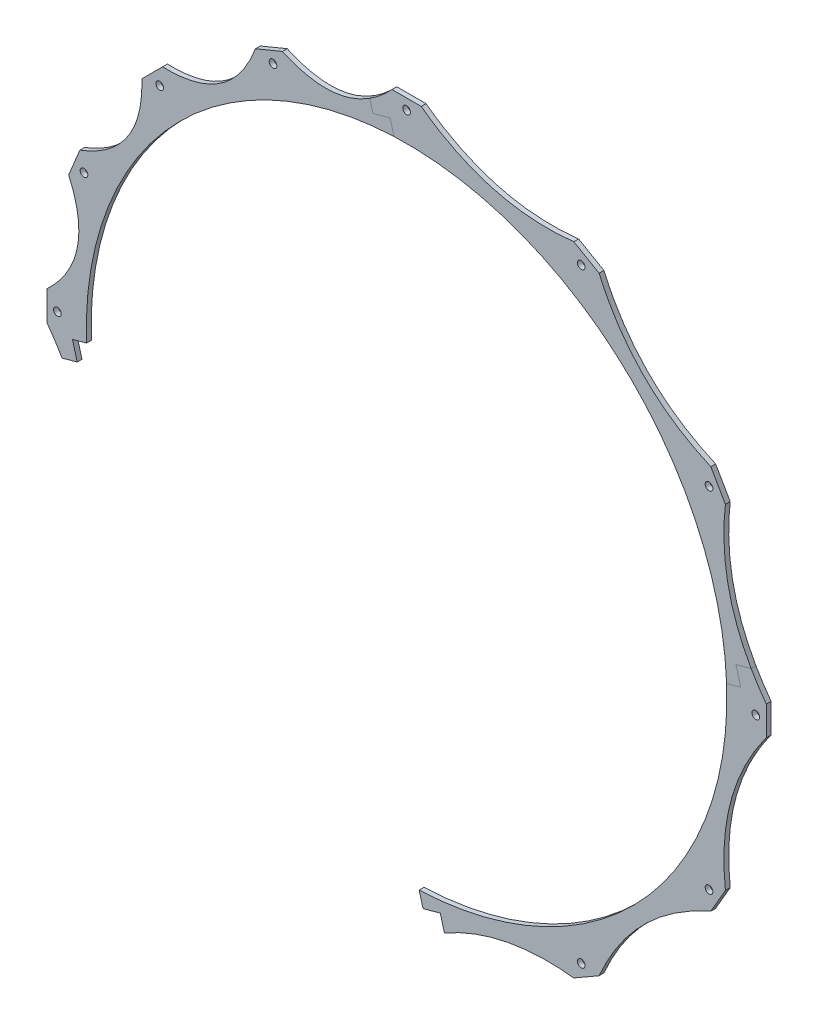
from build123d import *

# Parameters (mm, degrees)
SKETCH4_R           = 169.4688
SKETCH4_R_2         = 2.032
BOSS_EXTRUDE2_DEPTH = 2.54
SPLIT1_START        = -187
SPLIT1_OUTLINE_W    = 217.001338611
SPLIT1_OUTLINE_H    = 2.54
SPLIT1_DEPTH        = 373.122397647
SPLIT1_START_2      = 38.456242575
SPLIT1_2_OUTLINE_W  = 157.998661389
SPLIT1_2_OUTLINE_H  = 2.54
SPLIT1_2_DEPTH      = 147.666155072
SPLIT1_START_3      = 29.001338611
SPLIT1_3_OUTLINE_W  = 14.199535353
SPLIT1_3_OUTLINE_H  = 2.54
SPLIT1_3_DEPTH      = 9.454903964
SPLIT1_START_4      = -172.800464647
SPLIT1_4_OUTLINE_W  = 9.454903964
SPLIT1_4_OUTLINE_H  = 2.54
SPLIT1_4_DEPTH      = 31.915852609
SPLIT1_5_OUTLINE_R  = 2.032
SPLIT1_5_DEPTH      = 2.54
SPLIT1_6_OUTLINE_R  = 2.032
SPLIT1_6_DEPTH      = 2.54


with BuildPart() as part:
    # Sketch4 → Boss-Extrude2 (new body)
    with BuildSketch(Plane.XY):
        with BuildLine():
            Line((-7.735342369, 190.342886598), (7.735342369, 190.342886598))
            add(Edge.make_bspline(
                [(7.735342369, 190.342886598), (43.849986057, 163.650375876), (88.472440301, 168.709446408)],
                knots=[0, 0, 0, 1, 1, 1], degree=2))
            Line((88.472440301, 168.709446408), (101.870446297, 160.974104039))
            add(Edge.make_bspline(
                [(101.870446297, 160.974104039), (119.800389819, 119.800389819), (160.974104039, 101.870446297)],
                knots=[0, 0, 0, 1, 1, 1], degree=2))
            Line((160.974104039, 101.870446297), (168.709446408, 88.472440301))
            add(Edge.make_bspline(
                [(168.709446408, 88.472440301), (163.650375876, 43.849986057), (190.342886598, 7.735342369)],
                knots=[0, 0, 0, 1, 1, 1], degree=2))
            Line((190.342886598, 7.735342369), (190.342886598, -7.735342369))
            add(Edge.make_bspline(
                [(190.342886598, -7.735342369), (163.650375876, -43.849986057), (168.709446408, -88.472440301)],
                knots=[0, 0, 0, 1, 1, 1], degree=2))
            Line((168.709446408, -88.472440301), (160.974104039, -101.870446297))
            add(Edge.make_bspline(
                [(160.974104039, -101.870446297), (119.800389819, -119.800389819), (101.870446297, -160.974104039)],
                knots=[0, 0, 0, 1, 1, 1], degree=2))
            Line((101.870446297, -160.974104039), (88.472440301, -168.709446408))
            add(Edge.make_bspline(
                [(88.472440301, -168.709446408), (43.849986057, -163.650375876), (7.735342369, -190.342886598)],
                knots=[0, 0, 0, 1, 1, 1], degree=2))
            Line((7.735342369, -190.342886598), (-7.735342369, -190.342886598))
            add(Edge.make_bspline(
                [(-7.735342369, -190.342886598), (-43.849986057, -163.650375876), (-88.472440301, -168.709446408)],
                knots=[0, 0, 0, 1, 1, 1], degree=2))
            Line((-88.472440301, -168.709446408), (-101.870446297, -160.974104039))
            add(Edge.make_bspline(
                [(-101.870446297, -160.974104039), (-119.800389819, -119.800389819), (-160.974104039, -101.870446297)],
                knots=[0, 0, 0, 1, 1, 1], degree=2))
            Line((-160.974104039, -101.870446297), (-168.709446408, -88.472440301))
            add(Edge.make_bspline(
                [(-168.709446408, -88.472440301), (-163.650375876, -43.849986057), (-190.342886598, -7.735342369)],
                knots=[0, 0, 0, 1, 1, 1], degree=2))
            Line((-190.342886598, -7.735342369), (-190.342886598, 7.735342369))
            add(Edge.make_bspline(
                [(-190.342886598, 7.735342369), (-163.877360858, 32.597233808), (-178.814084455, 65.694544678)],
                knots=[0, 0, 0, 1, 1, 1], degree=2))
            Line((-178.814084455, 65.694544678), (-172.893709719, 79.987593661))
            add(Edge.make_bspline(
                [(-172.893709719, 79.987593661), (-138.92851822, 92.829068072), (-140.062458908, 129.12303282)],
                knots=[0, 0, 0, 1, 1, 1], degree=2))
            Line((-140.062458908, 129.12303282), (-129.12303282, 140.062458908))
            add(Edge.make_bspline(
                [(-129.12303282, 140.062458908), (-92.829068072, 138.92851822), (-79.987593661, 172.893709719)],
                knots=[0, 0, 0, 1, 1, 1], degree=2))
            Line((-79.987593661, 172.893709719), (-65.694544678, 178.814084455))
            add(Edge.make_bspline(
                [(-65.694544678, 178.814084455), (-32.597233808, 163.877360858), (-7.735342369, 190.342886598)],
                knots=[0, 0, 0, 1, 1, 1], degree=2))
        make_face()
        Circle(SKETCH4_R, mode=Mode.SUBTRACT)
        with Locations((0, 184.785)):
            Circle(SKETCH4_R_2, mode=Mode.SUBTRACT)
        with Locations((-160.028504238, -92.3925)):
            Circle(SKETCH4_R_2, mode=Mode.SUBTRACT)
        with Locations((-92.3925, -160.028504238)):
            Circle(SKETCH4_R_2, mode=Mode.SUBTRACT)
        with Locations((0, -184.785)):
            Circle(SKETCH4_R_2, mode=Mode.SUBTRACT)
        with Locations((92.3925, -160.028504238)):
            Circle(SKETCH4_R_2, mode=Mode.SUBTRACT)
        with Locations((160.028504238, -92.3925)):
            Circle(SKETCH4_R_2, mode=Mode.SUBTRACT)
        with Locations((184.785, 0)):
            Circle(SKETCH4_R_2, mode=Mode.SUBTRACT)
        with Locations((160.028504238, 92.3925)):
            Circle(SKETCH4_R_2, mode=Mode.SUBTRACT)
        with Locations((92.3925, 160.028504238)):
            Circle(SKETCH4_R_2, mode=Mode.SUBTRACT)
        with Locations((-70.71415805, 170.719079415)):
            Circle(SKETCH4_R_2, mode=Mode.SUBTRACT)
        with Locations((-130.662726562, 130.662726562)):
            Circle(SKETCH4_R_2, mode=Mode.SUBTRACT)
        with Locations((-170.719079415, 70.71415805)):
            Circle(SKETCH4_R_2, mode=Mode.SUBTRACT)
        with Locations((-184.785, 0)):
            Circle(SKETCH4_R_2, mode=Mode.SUBTRACT)
    extrude(amount=BOSS_EXTRUDE2_DEPTH)

    # Split1: read off the stored shape, not the designer's step
    # Split1 outline → Split1 (cut)
    with BuildSketch(Plane(origin=(0, 0, 0), x_dir=(-0.264985399113813, 0.96425242455308, 0), z_dir=(0.96425242455308, 0.264985399113813, 0)).offset(SPLIT1_START)):
        with Locations((-79.499330695, 1.27)):
            Rectangle(SPLIT1_OUTLINE_W, SPLIT1_OUTLINE_H)
    extrude(amount=SPLIT1_DEPTH, mode=Mode.SUBTRACT)

    # Split1 2 outline → Split1 2 (cut)
    with BuildSketch(Plane(origin=(0, 0, 0), x_dir=(-0.264985399113813, 0.96425242455308, 0), z_dir=(0.96425242455308, 0.264985399113813, 0)).offset(SPLIT1_START_2)):
        with Locations((108.000669305, 1.27)):
            Rectangle(SPLIT1_2_OUTLINE_W, SPLIT1_2_OUTLINE_H)
    extrude(amount=SPLIT1_2_DEPTH, mode=Mode.SUBTRACT)

    # Split1 3 outline → Split1 3 (cut)
    with BuildSketch(Plane(origin=(0, 0, 0), x_dir=(-0.264985399113813, 0.96425242455308, 0), z_dir=(0.96425242455308, 0.264985399113813, 0)).offset(SPLIT1_START_3)):
        with Locations((179.900232324, 1.27)):
            Rectangle(SPLIT1_3_OUTLINE_W, SPLIT1_3_OUTLINE_H)
    extrude(amount=SPLIT1_3_DEPTH, mode=Mode.SUBTRACT)

    # Split1 4 outline → Split1 4 (cut)
    with BuildSketch(Plane(origin=(0, 0, 0), x_dir=(-0.264985399113813, 0.96425242455308, 0), z_dir=(0.96425242455308, 0.264985399113813, 0)).offset(SPLIT1_START_4)):
        with Locations((33.728790593, 1.27)):
            Rectangle(SPLIT1_4_OUTLINE_W, SPLIT1_4_OUTLINE_H)
    extrude(amount=SPLIT1_4_DEPTH, mode=Mode.SUBTRACT)


with BuildPart() as body_2:
    # Split1 5 outline → Split1 5 (new body)
    with BuildSketch(Plane.XY):
        with BuildLine():
            Line((169.338128785, 6.653744292), (176.813609787, 8.708074949))
            Line((176.813609787, 8.708074949), (174.308198287, 17.824989021))
            Line((174.308198287, 17.824989021), (182.318082711, 20.026178634))
            add(Edge.make_bspline(
                [(182.318082711, 20.026178634), (164.494652391, 51.29674726), (168.709446408, 88.472440301)],
                knots=[0.166883721, 0.166883721, 0.166883721, 1, 1, 1], degree=2))
            Line((168.709446408, 88.472440301), (160.974104039, 101.870446297))
            add(Edge.make_bspline(
                [(160.974104039, 101.870446297), (119.800389819, 119.800389819), (101.870446297, 160.974104039)],
                knots=[0, 0, 0, 1, 1, 1], degree=2))
            Line((101.870446297, 160.974104039), (88.472440301, 168.709446408))
            add(Edge.make_bspline(
                [(88.472440301, 168.709446408), (43.849986057, 163.650375876), (7.735342369, 190.342886598)],
                knots=[0, 0, 0, 1, 1, 1], degree=2))
            Line((7.735342369, 190.342886598), (-7.735342369, 190.342886598))
            add(Edge.make_bspline(
                [(-7.735342369, 190.342886598), (-13.406219181, 184.306228583), (-19.505563426, 180.423621815)],
                knots=[0, 0, 0, 0.228095148, 0.228095148, 0.228095148], degree=2))
            Line((-19.505563426, 180.423621815), (-17.824989021, 174.308198287))
            Line((-17.824989021, 174.308198287), (-8.708074949, 176.813609787))
            Line((-8.708074949, 176.813609787), (-6.653744292, 169.338128785))
            ThreePointArc((-6.653744292, 169.338128785), (115.035231468, 124.445046886), (169.338128785, 6.653744292))
        make_face()
        with Locations((160.028504238, 92.3925)):
            Circle(SPLIT1_5_OUTLINE_R, mode=Mode.SUBTRACT)
        with Locations((0, 184.785)):
            Circle(SPLIT1_5_OUTLINE_R, mode=Mode.SUBTRACT)
        with Locations((92.3925, 160.028504238)):
            Circle(SPLIT1_5_OUTLINE_R, mode=Mode.SUBTRACT)
    extrude(amount=SPLIT1_5_DEPTH)


with BuildPart() as body_3:
    # Split1 6 outline → Split1 6 (new body)
    with BuildSketch(Plane.XY):
        with BuildLine():
            Line((6.653744292, -169.338128785), (8.708074949, -176.813609787))
            Line((8.708074949, -176.813609787), (17.824989021, -174.308198287))
            Line((17.824989021, -174.308198287), (20.026178634, -182.318082711))
            add(Edge.make_bspline(
                [(20.026178634, -182.318082711), (51.29674726, -164.494652391), (88.472440301, -168.709446408)],
                knots=[0.166883721, 0.166883721, 0.166883721, 1, 1, 1], degree=2))
            Line((88.472440301, -168.709446408), (101.870446297, -160.974104039))
            add(Edge.make_bspline(
                [(101.870446297, -160.974104039), (119.800389819, -119.800389819), (160.974104039, -101.870446297)],
                knots=[0, 0, 0, 1, 1, 1], degree=2))
            Line((160.974104039, -101.870446297), (168.709446408, -88.472440301))
            add(Edge.make_bspline(
                [(168.709446408, -88.472440301), (163.650375876, -43.849986057), (190.342886598, -7.735342369)],
                knots=[0, 0, 0, 1, 1, 1], degree=2))
            Line((190.342886598, -7.735342369), (190.342886598, 7.735342369))
            add(Edge.make_bspline(
                [(190.342886598, 7.735342369), (185.888341086, 13.762288489), (182.318082711, 20.026178634)],
                knots=[0, 0, 0, 0.166883721, 0.166883721, 0.166883721], degree=2))
            Line((182.318082711, 20.026178634), (174.308198287, 17.824989021))
            Line((174.308198287, 17.824989021), (176.813609787, 8.708074949))
            Line((176.813609787, 8.708074949), (169.338128785, 6.653744292))
            ThreePointArc((169.338128785, 6.653744292), (124.445046886, -115.035231468), (6.653744292, -169.338128785))
        make_face()
        with Locations((92.3925, -160.028504238)):
            Circle(SPLIT1_6_OUTLINE_R, mode=Mode.SUBTRACT)
        with Locations((160.028504238, -92.3925)):
            Circle(SPLIT1_6_OUTLINE_R, mode=Mode.SUBTRACT)
        with Locations((184.785, 0)):
            Circle(SPLIT1_6_OUTLINE_R, mode=Mode.SUBTRACT)
    extrude(amount=SPLIT1_6_DEPTH)


solid = Compound([part.part, body_2.part, body_3.part])
